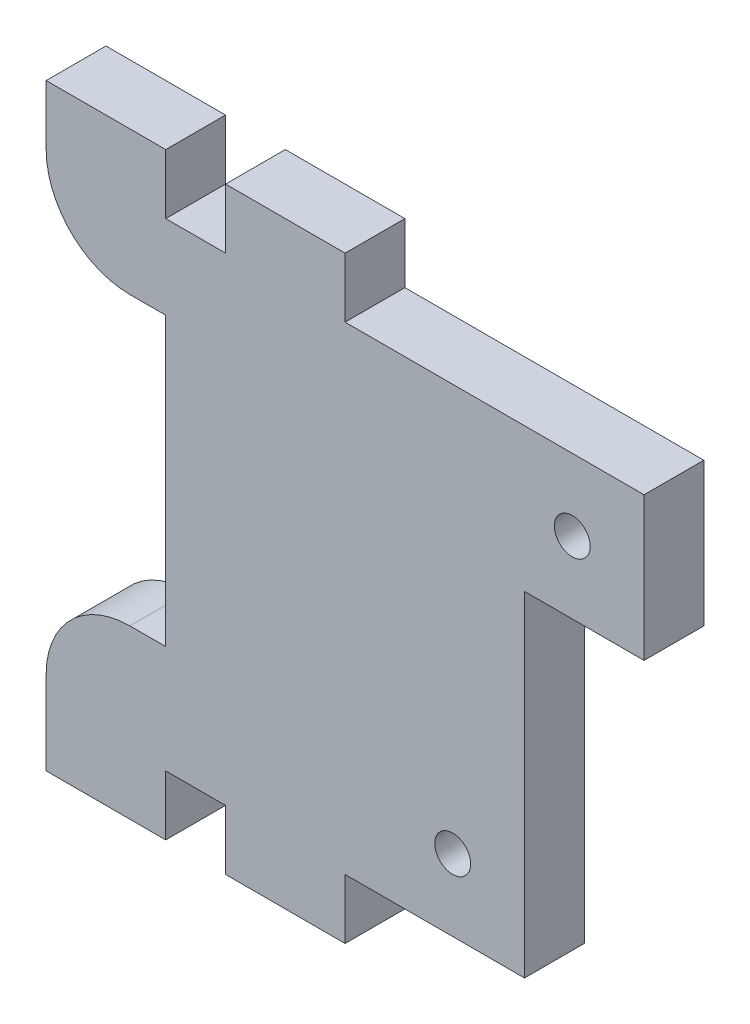
from build123d import *

# Parameters (mm, degrees)
ESQUISSE1_R        = 1.5
BOSS_EXTRU_1_DEPTH = 5
CONG_1_R           = 7


with BuildPart() as part:
    # Esquisse1 → Boss.-Extru.1 (new body)
    with BuildSketch(Plane.XY):
        Polygon((10, 0), (15, 0), (15, -5), (25, -5), (25, 0), (40, 0), (40, 28), (50, 28), (50, 40), (25, 40), (25, 45), (15, 45), (15, 40), (10, 40), (10, 45), (0, 45), (0, 40), (0, 33), (10, 33), (10, 9), (0, 9), (0, 0), (0, -5), (10, -5), align=None)
        with Locations((44, 34)):
            Circle(ESQUISSE1_R, mode=Mode.SUBTRACT)
        with Locations((34, 6)):
            Circle(ESQUISSE1_R, mode=Mode.SUBTRACT)
    extrude(amount=BOSS_EXTRU_1_DEPTH)

    # Congé1
    cong_1_edges = [part.edges().sort_by_distance(p)[0] for p in [
        (0, 9, 2.5),
        (0, 33, 2.5),
    ]]
    fillet(cong_1_edges, radius=CONG_1_R)


solid = part.part
